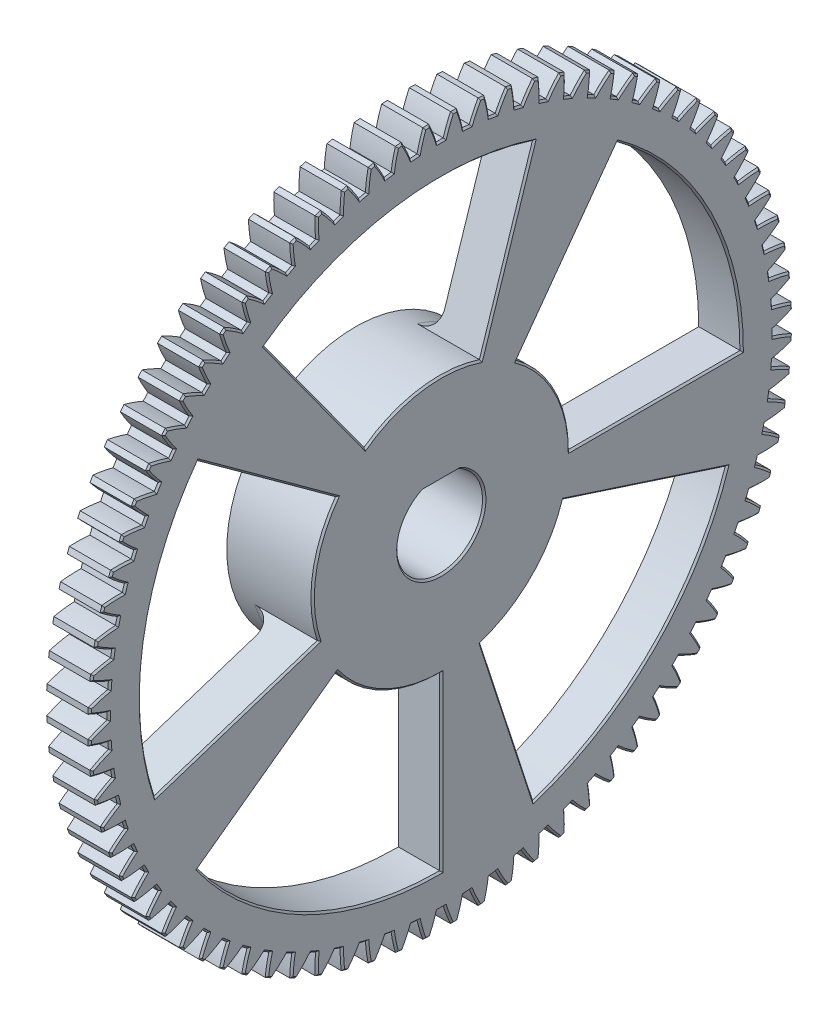
from build123d import *

# Parameters (mm, degrees)
BASPROSKE_W         = 10
BASPROSKE_H         = 82
TOOTHCUT_DEPTH      = 117.395876216
TEETHCUTS_COUNT     = 80
TEETHCUTS_ANGLE     = 355.5
HUBNEAONESKE_R      = 50
HUBNEARONE_DEPTH    = 10
BORSKE_R            = 10
BORE_DEPTH          = 15.0000508
EXTRUDE_START       = -20
EXTRUDE_1_DEPTH     = 20
CUT_EXTRUDE_1_DEPTH = 118.622521301
SKETCH_3_OUTSIDE_W  = 212.458
SKETCH_3_OUTSIDE_H  = 212.458
SKETCH_3_OUTSIDE_R  = 30
CUT_EXTRUDE_2_DEPTH = 10
FILLET_1_R          = 5
CHAMFER_1_SIZE      = 0.4


with BuildPart() as part:
    # BasProSke → Base-Revolve (revolve)
    with BuildSketch(Plane(origin=(0, 0, 0), x_dir=(1, 0, 0), z_dir=(0, 1, 0)), mode=Mode.PRIVATE) as base_revolve_sk:
        with Locations((5, 41)):
            Rectangle(BASPROSKE_W, BASPROSKE_H)
    revolve(base_revolve_sk.sketch.rotate(Axis((-10, 0, 0), (1, 0, 0)), 180), axis=Axis((-10, 0, 0), (1, 0, 0)))

    # TooCutSke → ToothCut (cut, through all)
    with BuildSketch(Plane(origin=(0, 0, 0), x_dir=(0, 0, -1), z_dir=(1, 0, 0))):
        with BuildLine():
            ThreePointArc((0.826151948, 77.494596418), (0, 77.499), (-0.826151948, 77.494596418))
            ThreePointArc((-0.826151948, 77.494596418), (-1.606395028, 79.772645896), (-2.555728345, 81.985574937))
            ThreePointArc((-2.555728345, 81.985574937), (0, 82.0254), (2.555728345, 81.985574937))
            ThreePointArc((2.555728345, 81.985574937), (1.606395028, 79.772645896), (0.826151948, 77.494596418))
        make_face()
    toothcut = extrude(amount=TOOTHCUT_DEPTH, mode=Mode.SUBTRACT)

    # TeethCuts: ToothCut ×80 about axis
    teethcuts_axis = Axis((-10, 0, 0), (1, 0, 0))
    for i in range(1, TEETHCUTS_COUNT):
        add(toothcut.rotate(teethcuts_axis, i * TEETHCUTS_ANGLE / (TEETHCUTS_COUNT - 1)), mode=Mode.SUBTRACT)

    # HubNeaOneSke → HubNearOne (add)
    with BuildSketch(Plane.ZY):
        with Locations(Location((0, 0, 0), (0, 0, 180))):
            Circle(HUBNEAONESKE_R)
    extrude(amount=HUBNEARONE_DEPTH)

    # BorSke → Bore (cut, symmetric)
    with BuildSketch(Plane(origin=(0, 0, 0), x_dir=(0, 0, -1), z_dir=(1, 0, 0))):
        with Locations(Location((0, 0, 0), (0, 0, 180))):
            Circle(BORSKE_R)
    extrude(amount=BORE_DEPTH, both=True, mode=Mode.SUBTRACT)

    # 草图1 → 凸台-拉伸1 (add)
    with BuildSketch(Plane.ZY.offset(10).offset(EXTRUDE_START)):
        with BuildLine():
            Line((-4.358898944, 9), (4.358898944, 9))
            ThreePointArc((4.358898944, 9), (0, 10), (-4.358898944, 9))
        make_face()
    extrude(amount=EXTRUDE_1_DEPTH)

    # 草图2 → 切除-拉伸1 (cut, through all)
    with BuildSketch(Plane(origin=(10, 0, 0), x_dir=(0, 0, -1), z_dir=(1, 0, 0))):
        with BuildLine():
            ThreePointArc((-17.633557569, 24.270509831), (-13.619714992, 26.730195726), (-9.270509831, 28.531695489))
            Line((-9.270509831, 28.531695489), (-21.631189606, 66.573956141))
            ThreePointArc((-21.631189606, 66.573956141), (-31.779334982, 62.370456693), (-41.14496766, 56.631189606))
            Line((-41.14496766, 56.631189606), (-17.633557569, 24.270509831))
        make_face()
        with BuildLine():
            ThreePointArc((-9.270509831, 28.531695489), (-4.693033951, 29.630650218), (0, 30))
            Line((0, 30), (0, 70))
            ThreePointArc((0, 70), (-10.950412553, 69.138183842), (-21.631189606, 66.573956141))
            Line((-21.631189606, 66.573956141), (-9.270509831, 28.531695489))
        make_face()
        with BuildLine():
            Line((0, 70), (0, 30))
            ThreePointArc((0, 30), (4.693033951, 29.630650218), (9.270509831, 28.531695489))
            Line((9.270509831, 28.531695489), (21.631189606, 66.573956141))
            ThreePointArc((21.631189606, 66.573956141), (10.950412553, 69.138183842), (0, 70))
        make_face()
        with BuildLine():
            Line((41.14496766, 56.631189606), (17.633557569, 24.270509831))
            ThreePointArc((17.633557569, 24.270509831), (21.213203436, 21.213203436), (24.270509831, 17.633557569))
            Line((24.270509831, 17.633557569), (56.631189606, 41.14496766))
            ThreePointArc((56.631189606, 41.14496766), (49.497474683, 49.497474683), (41.14496766, 56.631189606))
        make_face()
        with BuildLine():
            Line((56.631189606, 41.14496766), (24.270509831, 17.633557569))
            ThreePointArc((24.270509831, 17.633557569), (26.730195726, 13.619714992), (28.531695489, 9.270509831))
            Line((28.531695489, 9.270509831), (66.573956141, 21.631189606))
            ThreePointArc((66.573956141, 21.631189606), (62.370456693, 31.779334982), (56.631189606, 41.14496766))
        make_face()
        with BuildLine():
            Line((66.573956141, 21.631189606), (28.531695489, 9.270509831))
            ThreePointArc((28.531695489, 9.270509831), (29.630650218, 4.693033951), (30, 0))
            Line((30, 0), (70, 0))
            ThreePointArc((70, 0), (69.138183842, 10.950412553), (66.573956141, 21.631189606))
        make_face()
        with BuildLine():
            Line((66.573956141, -21.631189606), (28.531695489, -9.270509831))
            ThreePointArc((28.531695489, -9.270509831), (26.730195726, -13.619714992), (24.270509831, -17.633557569))
            Line((24.270509831, -17.633557569), (56.631189606, -41.14496766))
            ThreePointArc((56.631189606, -41.14496766), (62.370456693, -31.779334982), (66.573956141, -21.631189606))
        make_face()
        with BuildLine():
            Line((56.631189606, -41.14496766), (24.270509831, -17.633557569))
            ThreePointArc((24.270509831, -17.633557569), (21.213203436, -21.213203436), (17.633557569, -24.270509831))
            Line((17.633557569, -24.270509831), (41.14496766, -56.631189606))
            ThreePointArc((41.14496766, -56.631189606), (49.497474683, -49.497474683), (56.631189606, -41.14496766))
        make_face()
        with BuildLine():
            Line((41.14496766, -56.631189606), (17.633557569, -24.270509831))
            ThreePointArc((17.633557569, -24.270509831), (13.619714992, -26.730195726), (9.270509831, -28.531695489))
            Line((9.270509831, -28.531695489), (21.631189606, -66.573956141))
            ThreePointArc((21.631189606, -66.573956141), (31.779334982, -62.370456693), (41.14496766, -56.631189606))
        make_face()
        with BuildLine():
            ThreePointArc((0, -30), (-4.693033951, -29.630650218), (-9.270509831, -28.531695489))
            Line((-9.270509831, -28.531695489), (-21.631189606, -66.573956141))
            ThreePointArc((-21.631189606, -66.573956141), (-10.950412553, -69.138183842), (0, -70))
            Line((0, -70), (0, -30))
        make_face()
        with BuildLine():
            ThreePointArc((-9.270509831, -28.531695489), (-13.619714992, -26.730195726), (-17.633557569, -24.270509831))
            Line((-17.633557569, -24.270509831), (-41.14496766, -56.631189606))
            ThreePointArc((-41.14496766, -56.631189606), (-31.779334982, -62.370456693), (-21.631189606, -66.573956141))
            Line((-21.631189606, -66.573956141), (-9.270509831, -28.531695489))
        make_face()
        with BuildLine():
            ThreePointArc((-17.633557569, -24.270509831), (-21.213203436, -21.213203436), (-24.270509831, -17.633557569))
            Line((-24.270509831, -17.633557569), (-56.631189606, -41.14496766))
            ThreePointArc((-56.631189606, -41.14496766), (-49.497474683, -49.497474683), (-41.14496766, -56.631189606))
            Line((-41.14496766, -56.631189606), (-17.633557569, -24.270509831))
        make_face()
        with BuildLine():
            ThreePointArc((-28.531695489, -9.270509831), (-29.630650218, -4.693033951), (-30, 0))
            Line((-30, 0), (-70, 0))
            ThreePointArc((-70, 0), (-69.138183842, -10.950412553), (-66.573956141, -21.631189606))
            Line((-66.573956141, -21.631189606), (-28.531695489, -9.270509831))
        make_face()
        with BuildLine():
            ThreePointArc((-30, 0), (-29.630650218, 4.693033951), (-28.531695489, 9.270509831))
            Line((-28.531695489, 9.270509831), (-66.573956141, 21.631189606))
            ThreePointArc((-66.573956141, 21.631189606), (-69.138183842, 10.950412553), (-70, 0))
            Line((-70, 0), (-30, 0))
        make_face()
        with BuildLine():
            ThreePointArc((-28.531695489, 9.270509831), (-26.730195726, 13.619714992), (-24.270509831, 17.633557569))
            Line((-24.270509831, 17.633557569), (-56.631189606, 41.14496766))
            ThreePointArc((-56.631189606, 41.14496766), (-62.370456693, 31.779334982), (-66.573956141, 21.631189606))
            Line((-66.573956141, 21.631189606), (-28.531695489, 9.270509831))
        make_face()
    extrude(amount=-CUT_EXTRUDE_1_DEPTH, mode=Mode.SUBTRACT)

    # 草图3 outside → 切除-拉伸2 (cut)
    with BuildSketch(Plane.ZY.offset(10)):
        Rectangle(SKETCH_3_OUTSIDE_W, SKETCH_3_OUTSIDE_H)
        with Locations(Location((0, 0, 0), (0, 0, 180))):
            Circle(SKETCH_3_OUTSIDE_R, mode=Mode.SUBTRACT)
    extrude(amount=-CUT_EXTRUDE_2_DEPTH, mode=Mode.SUBTRACT)

    # 圆角1
    # the kernel refuses this fillet: 5 mm, written as the material it adds along each edge
    with BuildSketch(Plane(origin=(0, 0, 0), x_dir=(0, 0.5877852522923576, 0.8090169943750314), z_dir=(0, -0.8090169943750314, 0.5877852522923576))) as fillet_1_piece_1:
        with BuildLine():
            CenterArc((30 + FILLET_1_R, FILLET_1_R), FILLET_1_R, 180, 90)
            Line((30, FILLET_1_R), (30, 0))
            Line((30, 0), (30 + FILLET_1_R, 0))
        make_face()
    revolve(axis=Axis((0, 0, 0), (-1, 0, 0)), revolution_arc=18)
    with BuildSketch(Plane(origin=(0, 0, 0), x_dir=(0, 0.9510565162951613, -0.30901699437492347), z_dir=(0, 0.30901699437492347, 0.9510565162951613))) as fillet_1_piece_2:
        with BuildLine():
            CenterArc((30 + FILLET_1_R, FILLET_1_R), FILLET_1_R, 180, 90)
            Line((30, FILLET_1_R), (30, 0))
            Line((30, 0), (30 + FILLET_1_R, 0))
        make_face()
    revolve(axis=Axis((0, 0, 0), (-1, 0, 0)), revolution_arc=18)
    with BuildSketch(Plane(origin=(0, 0, 0), x_dir=(0, 0, -1), z_dir=(0, 1, 0))) as fillet_1_piece_3:
        with BuildLine():
            CenterArc((30 + FILLET_1_R, FILLET_1_R), FILLET_1_R, 180, 90)
            Line((30, FILLET_1_R), (30, 0))
            Line((30, 0), (30 + FILLET_1_R, 0))
        make_face()
    revolve(axis=Axis((0, 0, 0), (-1, 0, 0)), revolution_arc=18)
    with BuildSketch(Plane(origin=(0, 0, 0), x_dir=(0, -0.5877852522929095, 0.8090169943746303), z_dir=(0, -0.8090169943746303, -0.5877852522929095))) as fillet_1_piece_4:
        with BuildLine():
            CenterArc((30 + FILLET_1_R, FILLET_1_R), FILLET_1_R, 180, 90)
            Line((30, FILLET_1_R), (30, 0))
            Line((30, 0), (30 + FILLET_1_R, 0))
        make_face()
    revolve(axis=Axis((0, 0, 0), (-1, 0, 0)), revolution_arc=18)
    with BuildSketch(Plane(origin=(0, 0, 0), x_dir=(0, -0.9510565162949505, -0.30901699437557245), z_dir=(0, 0.30901699437557245, -0.9510565162949505))) as fillet_1_piece_5:
        with BuildLine():
            CenterArc((30 + FILLET_1_R, FILLET_1_R), FILLET_1_R, 180, 90)
            Line((30, FILLET_1_R), (30, 0))
            Line((30, 0), (30 + FILLET_1_R, 0))
        make_face()
    revolve(axis=Axis((0, 0, 0), (-1, 0, 0)), revolution_arc=18)

    # 倒角1
    chamfer_1_edges = [part.edges().sort_by_distance(p)[0] for p in [
        (10, 59.60972499, -53.017518979),
        (10, 61.689800783, -50.58206314),
        (10, 58.930701928, -50.331574298),
        (10, 55.266261505, -57.531008781),
        (10, 57.531008781, -55.266261505),
        (10, 54.800068435, -54.800068435),
        (10, 70.339397552, -37.63702677),
        (10, 71.793454811, -34.783278719),
        (10, 69.052114618, -35.183809739),
        (10, 67.169597578, -43.039769903),
        (10, 68.843074955, -40.308903022),
        (10, 66.078760097, -40.493116267),
        (10, 63.585674699, -48.177158543),
        (10, 65.468254649, -45.586009535),
        (10, 62.698008047, -45.552769267),
        (10, 40.308903022, -68.843074955),
        (10, 43.039769903, -67.169597578),
        (10, 40.493116267, -66.078760097),
        (10, 50.58206314, -61.689800783),
        (10, 53.017518979, -59.60972499),
        (10, 50.331574298, -58.930701928),
        (10, 45.586009535, -65.468254649),
        (10, 48.177158543, -63.585674699),
        (10, 45.552769267, -62.698008047),
        (10, 34.783278719, -71.793454811),
        (10, 37.63702677, -70.339397552),
        (10, 35.183809739, -69.052114618),
        (10, 29.043203935, -74.301204144),
        (10, 81.936780972, -3.219304892),
        (10, 32.002238851, -73.075531751),
        (10, 29.657583325, -71.59973989),
        (10, 23.124068141, -76.350861846),
        (10, 26.170146488, -75.361130995),
        (10, 23.948508047, -73.705928956),
        (10, 17.062364778, -77.929791096),
        (10, 20.176706469, -77.182103808),
        (10, 18.091782253, -75.357696461),
        (10, 10.895466262, -79.028257269),
        (10, 14.058870346, -78.527223284),
        (10, 12.123514606, -76.544858708),
        (10, 4.661393573, -79.639487957),
        (10, 7.854356611, -79.388196316),
        (10, 6.08050146, -77.260096447),
        (10, -1.601418157, -79.759714719),
        (10, 1.601418157, -79.759714719),
        (10, 0, -77.499),
        (10, 79.759714719, -1.601418157),
        (10, 79.759714719, 1.601418157),
        (10, 77.499, 0),
        (10, -10, 0),
        (10, 9, 0),
        (10, -50, 0),
        (10, -26.730195726, 13.619714992),
        (10, -29.389262615, 40.450849719),
        (10, -62.370456693, 31.779334982),
        (10, -15.450849719, 47.552825815),
        (10, 4.693033951, 29.630650218),
        (10, 29.389262615, 40.450849719),
        (10, 10.950412553, 69.138183842),
        (10, -15.450849719, -47.552825815),
        (10, -21.213203436, -21.213203436),
        (10, -47.552825815, -15.450849719),
        (10, -49.497474683, -49.497474683),
        (10, 40.450849719, -29.389262615),
        (10, 13.619714992, -26.730195726),
        (10, 0, -50),
        (10, 31.779334982, -62.370456693),
        (10, 40.450849719, 29.389262615),
        (10, 29.630650218, 4.693033951),
        (10, 47.552825815, -15.450849719),
        (10, 69.138183842, 10.950412553),
        (10, 81.43161347, -9.638066592),
        (10, 80.424392993, -15.997406405),
        (10, 78.921329389, -22.258116889),
        (10, 76.931689546, -28.38159868),
        (10, 74.467740254, -34.330098478),
        (10, 71.54467258, -40.066941803),
        (10, 68.180508209, -45.556759108),
        (10, 64.395988332, -50.765703843),
        (10, 60.214445774, -55.661661134),
        (10, 55.661661134, -60.214445774),
        (10, 50.765703843, -64.395988332),
        (10, 45.556759108, -68.180508209),
        (10, 40.066941803, -71.54467258),
        (10, 34.330098478, -74.467740254),
        (10, 28.38159868, -76.931689546),
        (10, 22.258116889, -78.921329389),
        (10, 15.997406405, -80.424392993),
        (10, 9.638066592, -81.43161347),
        (10, 3.219304892, -81.936780972),
        (10, -3.219304892, -81.936780972),
        (10, -9.638066592, -81.43161347),
        (10, -15.997406405, -80.424392993),
        (10, -22.258116889, -78.921329389),
        (10, -28.38159868, -76.931689546),
        (10, -34.330098478, -74.467740254),
        (10, -40.066941803, -71.54467258),
        (10, -45.556759108, -68.180508209),
        (10, -50.765703843, -64.395988332),
        (10, -55.661661134, -60.214445774),
        (10, -60.214445774, -55.661661134),
        (10, -64.395988332, -50.765703843),
        (10, -68.180508209, -45.556759108),
        (10, -71.54467258, -40.066941803),
        (10, -74.467740254, -34.330098478),
        (10, -76.931689546, -28.38159868),
        (10, -78.921329389, -22.258116889),
        (10, -80.424392993, -15.997406405),
        (10, -81.43161347, -9.638066592),
        (10, -81.936780972, -3.219304892),
        (10, -81.936780972, 3.219304892),
        (10, -81.43161347, 9.638066592),
        (10, -80.424392993, 15.997406405),
        (10, -78.921329389, 22.258116889),
        (10, -76.931689546, 28.38159868),
        (10, -74.467740254, 34.330098478),
        (10, -71.54467258, 40.066941803),
        (10, -68.180508209, 45.556759108),
        (10, -64.395988332, 50.765703843),
        (10, -60.214445774, 55.661661134),
        (10, -55.661661134, 60.214445774),
        (10, -50.765703843, 64.395988332),
        (10, -45.556759108, 68.180508209),
        (10, -40.066941803, 71.54467258),
        (10, -34.330098478, 74.467740254),
        (10, -28.38159868, 76.931689546),
        (10, -22.258116889, 78.921329389),
        (10, -15.997406405, 80.424392993),
        (10, -9.638066592, 81.43161347),
        (10, -3.219304892, 81.936780972),
        (10, 3.219304892, 81.936780972),
        (10, 9.638066592, 81.43161347),
        (10, 15.997406405, 80.424392993),
        (10, 22.258116889, 78.921329389),
        (10, 28.38159868, 76.931689546),
        (10, 34.330098478, 74.467740254),
        (10, 40.066941803, 71.54467258),
        (10, 45.556759108, 68.180508209),
        (10, 50.765703843, 64.395988332),
        (10, 55.661661134, 60.214445774),
        (10, 60.214445774, 55.661661134),
        (10, 64.395988332, 50.765703843),
        (10, 68.180508209, 45.556759108),
        (10, 71.54467258, 40.066941803),
        (10, 74.467740254, 34.330098478),
        (10, 76.931689546, 28.38159868),
        (10, 78.921329389, 22.258116889),
        (10, 80.424392993, 15.997406405),
        (10, 81.43161347, 9.638066592),
        (10, 81.936780972, 3.219304892),
        (10, 79.639487957, 4.661393573),
        (10, 79.388196316, 7.854356611),
        (10, 77.260096447, 6.08050146),
        (10, 1.601418157, 79.759714719),
        (10, -1.601418157, 79.759714719),
        (10, 0, 77.499),
        (10, 7.854356611, 79.388196316),
        (10, 4.661393573, 79.639487957),
        (10, 6.08050146, 77.260096447),
        (10, 14.058870346, 78.527223284),
        (10, 10.895466262, 79.028257269),
        (10, 12.123514606, 76.544858708),
        (10, 20.176706469, 77.182103808),
        (10, 17.062364778, 77.929791096),
        (10, 18.091782253, 75.357696461),
        (10, 26.170146488, 75.361130995),
        (10, 23.124068141, 76.350861846),
        (10, 23.948508047, 73.705928956),
        (10, 48.177158543, 63.585674699),
        (10, 45.586009535, 65.468254649),
        (10, 45.552769267, 62.698008047),
        (10, 53.017518979, 59.60972499),
        (10, 50.58206314, 61.689800783),
        (10, 50.331574298, 58.930701928),
        (10, 43.039769903, 67.169597578),
        (10, 40.308903022, 68.843074955),
        (10, 40.493116267, 66.078760097),
        (10, 37.63702677, 70.339397552),
        (10, 34.783278719, 71.793454811),
        (10, 35.183809739, 69.052114618),
        (10, 32.002238851, 73.075531751),
        (10, 29.043203935, 74.301204144),
        (10, 29.657583325, 71.59973989),
        (10, 71.793454811, 34.783278719),
        (10, 70.339397552, 37.63702677),
        (10, 69.052114618, 35.183809739),
        (10, 68.843074955, 40.308903022),
        (10, 67.169597578, 43.039769903),
        (10, 66.078760097, 40.493116267),
        (10, 61.689800783, 50.58206314),
        (10, 59.60972499, 53.017518979),
        (10, 58.930701928, 50.331574298),
        (10, 57.531008781, 55.266261505),
        (10, 55.266261505, 57.531008781),
        (10, 54.800068435, 54.800068435),
        (10, 65.468254649, 45.586009535),
        (10, 63.585674699, 48.177158543),
        (10, 62.698008047, 45.552769267),
        (10, 74.301204144, 29.043203935),
        (10, 73.075531751, 32.002238851),
        (10, 71.59973989, 29.657583325),
        (10, 76.350861846, 23.124068141),
        (10, 75.361130995, 26.170146488),
        (10, 73.705928956, 23.948508047),
        (10, 77.929791096, 17.062364778),
        (10, 77.182103808, 20.176706469),
        (10, 75.357696461, 18.091782253),
        (10, 79.028257269, 10.895466262),
        (10, 78.527223284, 14.058870346),
        (10, 76.544858708, 12.123514606),
        (10, -79.759714719, 1.601418157),
        (10, -79.759714719, -1.601418157),
        (10, -77.499, 0),
        (10, -79.388196316, 7.854356611),
        (10, -79.639487957, 4.661393573),
        (10, -77.260096447, 6.08050146),
        (10, -78.527223284, 14.058870346),
        (10, -79.028257269, 10.895466262),
        (10, -76.544858708, 12.123514606),
        (10, -77.182103808, 20.176706469),
        (10, -77.929791096, 17.062364778),
        (10, -75.357696461, 18.091782253),
        (10, -75.361130995, 26.170146488),
        (10, -76.350861846, 23.124068141),
        (10, -73.705928956, 23.948508047),
        (10, -63.585674699, 48.177158543),
        (10, -65.468254649, 45.586009535),
        (10, -62.698008047, 45.552769267),
        (10, -59.60972499, 53.017518979),
        (10, -61.689800783, 50.58206314),
        (10, -58.930701928, 50.331574298),
        (10, -67.169597578, 43.039769903),
        (10, -68.843074955, 40.308903022),
        (10, -66.078760097, 40.493116267),
        (10, -70.339397552, 37.63702677),
        (10, -71.793454811, 34.783278719),
        (10, -69.052114618, 35.183809739),
        (10, -73.075531751, 32.002238851),
        (10, -74.301204144, 29.043203935),
        (10, -71.59973989, 29.657583325),
        (10, -34.783278719, 71.793454811),
        (10, -37.63702677, 70.339397552),
        (10, -35.183809739, 69.052114618),
        (10, -40.308903022, 68.843074955),
        (10, -43.039769903, 67.169597578),
        (10, -40.493116267, 66.078760097),
        (10, -50.58206314, 61.689800783),
        (10, -53.017518979, 59.60972499),
        (10, -50.331574298, 58.930701928),
        (10, -55.266261505, 57.531008781),
        (10, -57.531008781, 55.266261505),
        (10, -54.800068435, 54.800068435),
        (10, -45.586009535, 65.468254649),
        (10, -48.177158543, 63.585674699),
        (10, -45.552769267, 62.698008047),
        (10, -29.043203935, 74.301204144),
        (10, -32.002238851, 73.075531751),
        (10, -29.657583325, 71.59973989),
        (10, -23.124068141, 76.350861846),
        (10, -26.170146488, 75.361130995),
        (10, -23.948508047, 73.705928956),
        (10, -17.062364778, 77.929791096),
        (10, -20.176706469, 77.182103808),
        (10, -18.091782253, 75.357696461),
        (10, -10.895466262, 79.028257269),
        (10, -14.058870346, 78.527223284),
        (10, -12.123514606, 76.544858708),
        (10, -4.661393573, 79.639487957),
        (10, -7.854356611, 79.388196316),
        (10, -6.08050146, 77.260096447),
        (10, -7.854356611, -79.388196316),
        (10, -4.661393573, -79.639487957),
        (10, -6.08050146, -77.260096447),
        (10, -14.058870346, -78.527223284),
        (10, -10.895466262, -79.028257269),
        (10, -12.123514606, -76.544858708),
        (10, -20.176706469, -77.182103808),
        (10, -17.062364778, -77.929791096),
        (10, -18.091782253, -75.357696461),
        (10, -26.170146488, -75.361130995),
        (10, -23.124068141, -76.350861846),
        (10, -23.948508047, -73.705928956),
        (10, -32.002238851, -73.075531751),
        (10, -29.043203935, -74.301204144),
        (10, -29.657583325, -71.59973989),
        (10, -53.017518979, -59.60972499),
        (10, -50.58206314, -61.689800783),
        (10, -50.331574298, -58.930701928),
        (10, -57.531008781, -55.266261505),
        (10, -55.266261505, -57.531008781),
        (10, -54.800068435, -54.800068435),
        (10, -37.63702677, -70.339397552),
        (10, -34.783278719, -71.793454811),
        (10, -35.183809739, -69.052114618),
        (10, -43.039769903, -67.169597578),
        (10, -40.308903022, -68.843074955),
        (10, -40.493116267, -66.078760097),
        (10, -48.177158543, -63.585674699),
        (10, -45.586009535, -65.468254649),
        (10, -45.552769267, -62.698008047),
        (10, -68.843074955, -40.308903022),
        (10, -67.169597578, -43.039769903),
        (10, -66.078760097, -40.493116267),
        (10, -61.689800783, -50.58206314),
        (10, -59.60972499, -53.017518979),
        (10, -58.930701928, -50.331574298),
        (10, -65.468254649, -45.586009535),
        (10, -63.585674699, -48.177158543),
        (10, -62.698008047, -45.552769267),
        (10, -71.793454811, -34.783278719),
        (10, -70.339397552, -37.63702677),
        (10, -69.052114618, -35.183809739),
        (10, -74.301204144, -29.043203935),
        (10, -73.075531751, -32.002238851),
        (10, -71.59973989, -29.657583325),
        (10, -76.350861846, -23.124068141),
        (10, -75.361130995, -26.170146488),
        (10, -73.705928956, -23.948508047),
        (10, -77.929791096, -17.062364778),
        (10, -77.182103808, -20.176706469),
        (10, -75.357696461, -18.091782253),
        (10, -79.028257269, -10.895466262),
        (10, -78.527223284, -14.058870346),
        (10, -76.544858708, -12.123514606),
        (10, -79.639487957, -4.661393573),
        (10, -79.388196316, -7.854356611),
        (10, -77.260096447, -6.08050146),
        (10, 79.388196316, -7.854356611),
        (10, 79.639487957, -4.661393573),
        (10, 77.260096447, -6.08050146),
        (10, 78.527223284, -14.058870346),
        (10, 79.028257269, -10.895466262),
        (10, 76.544858708, -12.123514606),
        (10, 77.182103808, -20.176706469),
        (10, 77.929791096, -17.062364778),
        (10, 75.357696461, -18.091782253),
        (10, 75.361130995, -26.170146488),
        (10, 76.350861846, -23.124068141),
        (10, 73.705928956, -23.948508047),
        (10, 73.075531751, -32.002238851),
        (10, 74.301204144, -29.043203935),
        (10, 71.59973989, -29.657583325),
    ]]
    chamfer(chamfer_1_edges, length=CHAMFER_1_SIZE)


solid = part.part
